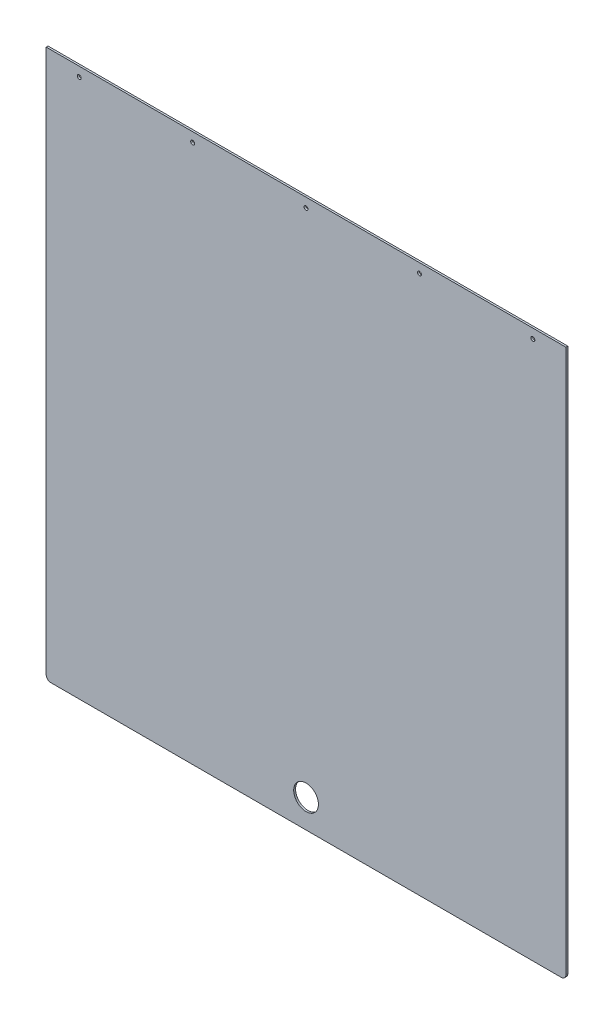
from build123d import *

# Parameters (mm, degrees)
SZKIC1_W                   = 550
SZKIC1_H                   = 580
ODGI_CIE_BAZOWE1_DEPTH     = 2
ZAOKR_GLENIE1_R            = 5
WYTNIJ_WYCI_GNI_CIE2_REACH = 401.661
SZKIC3_R                   = 2.1
WYTNIJ_WYCI_GNI_CIE3_REACH = 401.661
SZKIC4_R                   = 13.1


# Sheet-metal steps are written as plain solids
with BuildPart() as part:
    # Szkic1 → Odgięcie bazowe1 (new body)
    with BuildSketch(Plane.XY):
        Rectangle(SZKIC1_W, SZKIC1_H)
    extrude(amount=-ODGI_CIE_BAZOWE1_DEPTH)

    # Zaokrąglenie1
    zaokr_glenie1_edges = [part.edges().sort_by_distance(p)[0] for p in [
        (275, -290, -1),
        (-275, -290, -1),
    ]]
    fillet(zaokr_glenie1_edges, radius=ZAOKR_GLENIE1_R)

    # Szkic3 → Wytnij-wyciągnięcie2 (cut, up to next)
    with BuildSketch(Plane.XY, mode=Mode.PRIVATE) as wytnij_wyci_gni_cie2_sk1:
        with Locations((0, 280)):
            Circle(SZKIC3_R)
    wytnij_wyci_gni_cie2_tool1 = extrude(wytnij_wyci_gni_cie2_sk1.sketch, amount=-WYTNIJ_WYCI_GNI_CIE2_REACH, mode=Mode.PRIVATE) & part.part
    # Szkic3 → Wytnij-wyciągnięcie2 (cut, up to next)
    with BuildSketch(Plane.XY, mode=Mode.PRIVATE) as wytnij_wyci_gni_cie2_sk2:
        with Locations((120, 280)):
            Circle(SZKIC3_R)
    wytnij_wyci_gni_cie2_tool2 = extrude(wytnij_wyci_gni_cie2_sk2.sketch, amount=-WYTNIJ_WYCI_GNI_CIE2_REACH, mode=Mode.PRIVATE) & part.part
    # Szkic3 → Wytnij-wyciągnięcie2 (cut, up to next)
    with BuildSketch(Plane.XY, mode=Mode.PRIVATE) as wytnij_wyci_gni_cie2_sk3:
        with Locations((240, 280)):
            Circle(SZKIC3_R)
    wytnij_wyci_gni_cie2_tool3 = extrude(wytnij_wyci_gni_cie2_sk3.sketch, amount=-WYTNIJ_WYCI_GNI_CIE2_REACH, mode=Mode.PRIVATE) & part.part
    # Szkic3 → Wytnij-wyciągnięcie2 (cut, up to next)
    with BuildSketch(Plane.XY, mode=Mode.PRIVATE) as wytnij_wyci_gni_cie2_sk4:
        with Locations(Location((-240, 280, 0), (0, 0, 180))):
            Circle(SZKIC3_R)
    wytnij_wyci_gni_cie2_tool4 = extrude(wytnij_wyci_gni_cie2_sk4.sketch, amount=-WYTNIJ_WYCI_GNI_CIE2_REACH, mode=Mode.PRIVATE) & part.part
    # Szkic3 → Wytnij-wyciągnięcie2 (cut, up to next)
    with BuildSketch(Plane.XY, mode=Mode.PRIVATE) as wytnij_wyci_gni_cie2_sk5:
        with Locations(Location((-120, 280, 0), (0, 0, 180))):
            Circle(SZKIC3_R)
    wytnij_wyci_gni_cie2_tool5 = extrude(wytnij_wyci_gni_cie2_sk5.sketch, amount=-WYTNIJ_WYCI_GNI_CIE2_REACH, mode=Mode.PRIVATE) & part.part
    add(wytnij_wyci_gni_cie2_tool1.solids().sort_by_distance((0, 280, 0))[0], mode=Mode.SUBTRACT)
    add(wytnij_wyci_gni_cie2_tool2.solids().sort_by_distance((120, 280, 0))[0], mode=Mode.SUBTRACT)
    add(wytnij_wyci_gni_cie2_tool3.solids().sort_by_distance((240, 280, 0))[0], mode=Mode.SUBTRACT)
    add(wytnij_wyci_gni_cie2_tool4.solids().sort_by_distance((-240, 280, 0))[0], mode=Mode.SUBTRACT)
    add(wytnij_wyci_gni_cie2_tool5.solids().sort_by_distance((-120, 280, 0))[0], mode=Mode.SUBTRACT)

    # Szkic4 → Wytnij-wyciągnięcie3 (cut, up to next)
    with BuildSketch(Plane(origin=(0, 0, -2), x_dir=(-1, 0, 0), z_dir=(0, 0, -1)), mode=Mode.PRIVATE) as wytnij_wyci_gni_cie3_sk1:
        with Locations((0, -260)):
            Circle(SZKIC4_R)
    wytnij_wyci_gni_cie3_tool1 = extrude(wytnij_wyci_gni_cie3_sk1.sketch, amount=-WYTNIJ_WYCI_GNI_CIE3_REACH, mode=Mode.PRIVATE) & part.part
    add(wytnij_wyci_gni_cie3_tool1.solids().sort_by_distance((0, -260, -2))[0], mode=Mode.SUBTRACT)


solid = part.part
